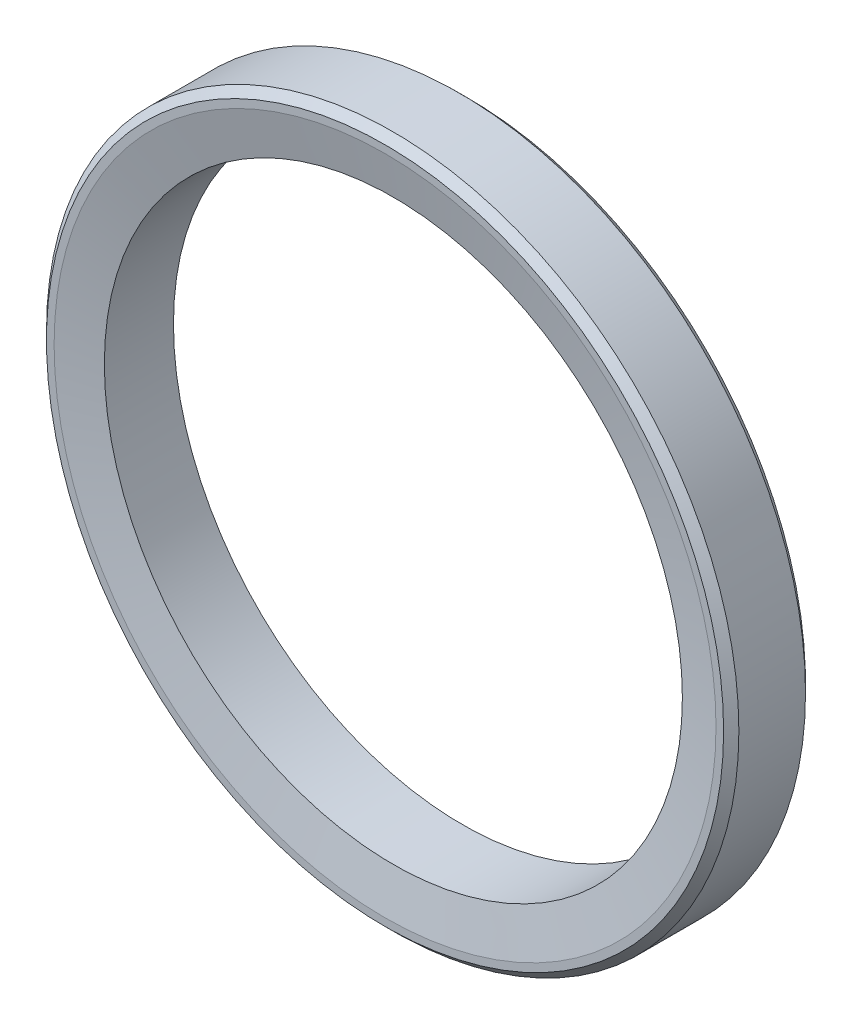
from build123d import *

# Parameters (mm, degrees)
CHAMFER1_SIZE = 0.5


with BuildPart() as part:
    # Sketch2 → Revolve1 (revolve)
    with BuildSketch(Plane(origin=(0, 0, 0), x_dir=(0, 0, -1), z_dir=(1, 0, 0)), mode=Mode.PRIVATE) as revolve1_sk:
        Polygon((-2.810478001, 22.7), (2.559521999, 22.7), (2.559521999, 22.2), (2.265464537, 18.95), (-2.265464537, 18.95), (-2.810478001, 21.7), align=None)
    revolve(revolve1_sk.sketch.rotate(Axis((0, 0, -1.408758661), (0, 0, 1)), 90), axis=Axis((0, 0, -1.408758661), (0, 0, 1)))

    # Chamfer1
    chamfer1_edges = [part.edges().sort_by_distance(p)[0] for p in [
        (22.7, 0, 2.810478001),
        (22.7, 0, -2.559521999),
    ]]
    chamfer(chamfer1_edges, length=CHAMFER1_SIZE - 0.0001)  # a hair under: the kernel refuses the full size


solid = part.part
